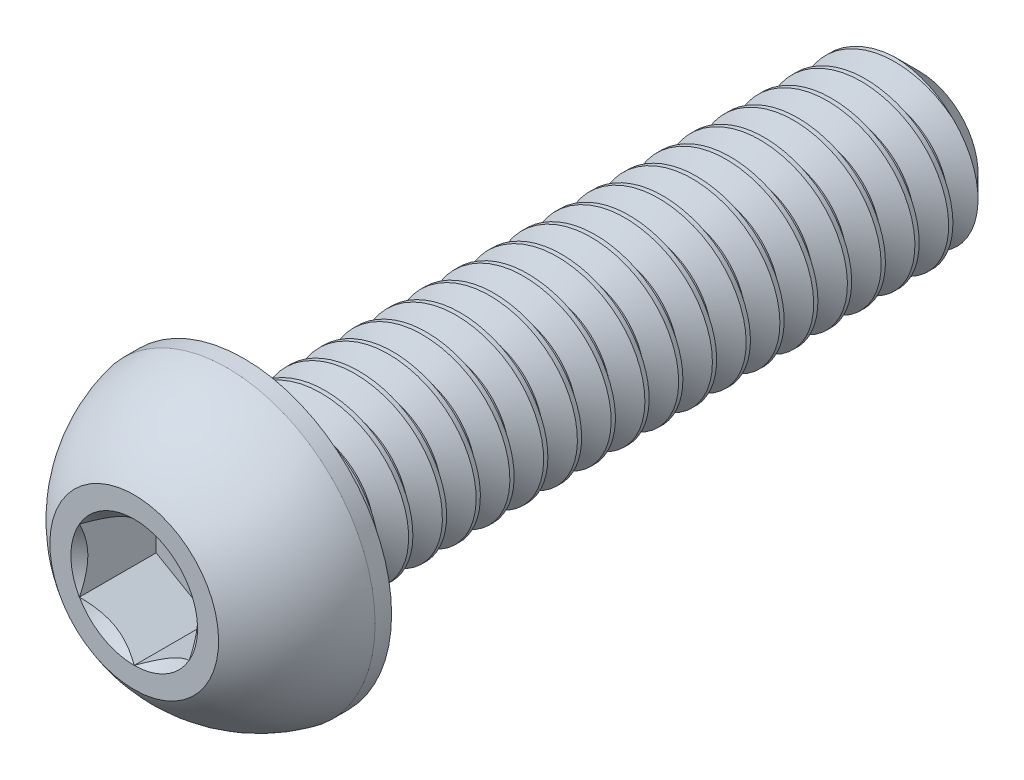
from build123d import *

# Parameters (mm, degrees)
SKETCH1_W          = 8
SKETCH1_H          = 1
CHAMFER1_SIZE      = 0.3
CUT_EXTRUDE2_DEPTH = 0.91
CUT_SWEEP1_PITCH   = 0.4


with BuildPart() as part:
    # Sketch1 → Revolve1 (revolve)
    with BuildSketch(Plane(origin=(0, 0, 0), x_dir=(0, 0, -1), z_dir=(1, 0, 0))):
        with Locations((5.3, 0.5)):
            Rectangle(SKETCH1_W, SKETCH1_H)
    revolve(axis=Axis((0, 0, -9.3), (0, 0, 1)))

    # Chamfer1
    chamfer1_edges = [part.edges().sort_by_distance(p)[0] for p in [
        (0, -1, -9.3),
    ]]
    chamfer(chamfer1_edges, length=CHAMFER1_SIZE)

    # Sketch7 → Revolve2 (revolve)
    with BuildSketch(Plane(origin=(0, 0, 0), x_dir=(0, 0, -1), z_dir=(1, 0, 0)), mode=Mode.PRIVATE) as revolve2_sk:
        with BuildLine():
            Line((1.105, 1.75), (1.3, 1.75))
            Line((1.3, 1.75), (1.3, 0))
            Line((1.3, 0), (0, 0))
            Line((0, 0), (0, 1))
            ThreePointArc((0, 1), (0.479976957, 1.481850617), (1.105, 1.75))
        make_face()
    revolve(revolve2_sk.sketch.rotate(Axis((0, 0, 0), (0, 0, -1)), 180), axis=Axis((0, 0, 0), (0, 0, -1)))

    # Sketch5 → Cut-Extrude2 (cut)
    with BuildSketch(Plane.XY):
        Polygon((0.65, -0.375277675), (0.65, 0.375277675), (0, 0.75055535), (-0.65, 0.375277675), (-0.65, -0.375277675), (0, -0.75055535), align=None)
    extrude(amount=-CUT_EXTRUDE2_DEPTH, mode=Mode.SUBTRACT)

    # Cut-Extrude3 cone 1 section (through the dimple's axis) → Cut-Extrude3 (revolve, cut)
    with BuildSketch(Plane(origin=(0, 0, 0), x_dir=(0, -1, 0), z_dir=(1, 0, 0))):
        Polygon((0, 0), (0.75055535, 0), (0, 0.75055535), align=None)
    revolve(axis=Axis((0, 0, 0), (0, 0, -1)), mode=Mode.SUBTRACT)

    # Cut-Sweep1: the profile of Sketch2 profile screwed along a right-hand helix of 21 turns, 6 arcs to a turn; built about Z, then put on its axis
    cut_sweep1_z = Axis((0, 0, 0), (0, 0, 1))
    cut_sweep1_corners = [(1.0003, 0, 0.300173205), (1.0003, 0, -0.050173205), (0.740192379, 0, 0.1), (0.740192379, 0, 0.15)]
    with BuildLine(mode=Mode.PRIVATE) as cut_sweep1_profile:
        Line(cut_sweep1_corners[0], cut_sweep1_corners[1])
        Line(cut_sweep1_corners[1], cut_sweep1_corners[2])
        Line(cut_sweep1_corners[2], cut_sweep1_corners[3])
        Line(cut_sweep1_corners[3], cut_sweep1_corners[0])
    cut_sweep1_cap = Face(cut_sweep1_profile.wire())
    cut_sweep1_turn_angles = [0, 30, 60, 90, 120, 150, 180, 210, 240, 270, 300, 330, 360]
    cut_sweep1_turn_weights = [1, 0.8660254037844387, 1, 0.8660254037844387, 1, 0.8660254037844387, 1, 0.8660254037844387, 1, 0.8660254037844387, 1, 0.8660254037844387, 1]
    cut_sweep1_turn_rails = [Edge.make_bspline([Vector(p[0], p[1], 0).rotate(cut_sweep1_z, cut_sweep1_turn_angles[k]) / cut_sweep1_turn_weights[k] + Vector(0, 0, p[2] + CUT_SWEEP1_PITCH * cut_sweep1_turn_angles[k] / 360) for k in range(13)], [0, 0, 0, 1, 1, 2, 2, 3, 3, 4, 4, 5, 5, 6, 6, 6], 2, cut_sweep1_turn_weights) for p in cut_sweep1_corners]
    cut_sweep1_turn_sides = [Face.make_surface_from_curves(cut_sweep1_turn_rails[p[0]], cut_sweep1_turn_rails[p[1]]) for p in [(0, 1), (1, 2), (2, 3), (3, 0)]]
    cut_sweep1_turn = Solid(Shell([*cut_sweep1_turn_sides, cut_sweep1_cap, cut_sweep1_cap.rotate(cut_sweep1_z, 360).moved(Location((0, 0, CUT_SWEEP1_PITCH * 360 / 360)))]))
    cut_sweep1_each = [*[cut_sweep1_turn.moved(Location((0, 0, CUT_SWEEP1_PITCH * i))) for i in range(21)]]
    add(Plane(origin=(0, 0, -9.3), x_dir=(0, 1, 0), z_dir=(0, 0, 1)) * Compound([cut_sweep1_each[i] for i in range(0, 21, 2)]), mode=Mode.SUBTRACT)
    add(Plane(origin=(0, 0, -9.3), x_dir=(0, 1, 0), z_dir=(0, 0, 1)) * Compound([cut_sweep1_each[i] for i in range(1, 21, 2)]), mode=Mode.SUBTRACT)


solid = part.part
